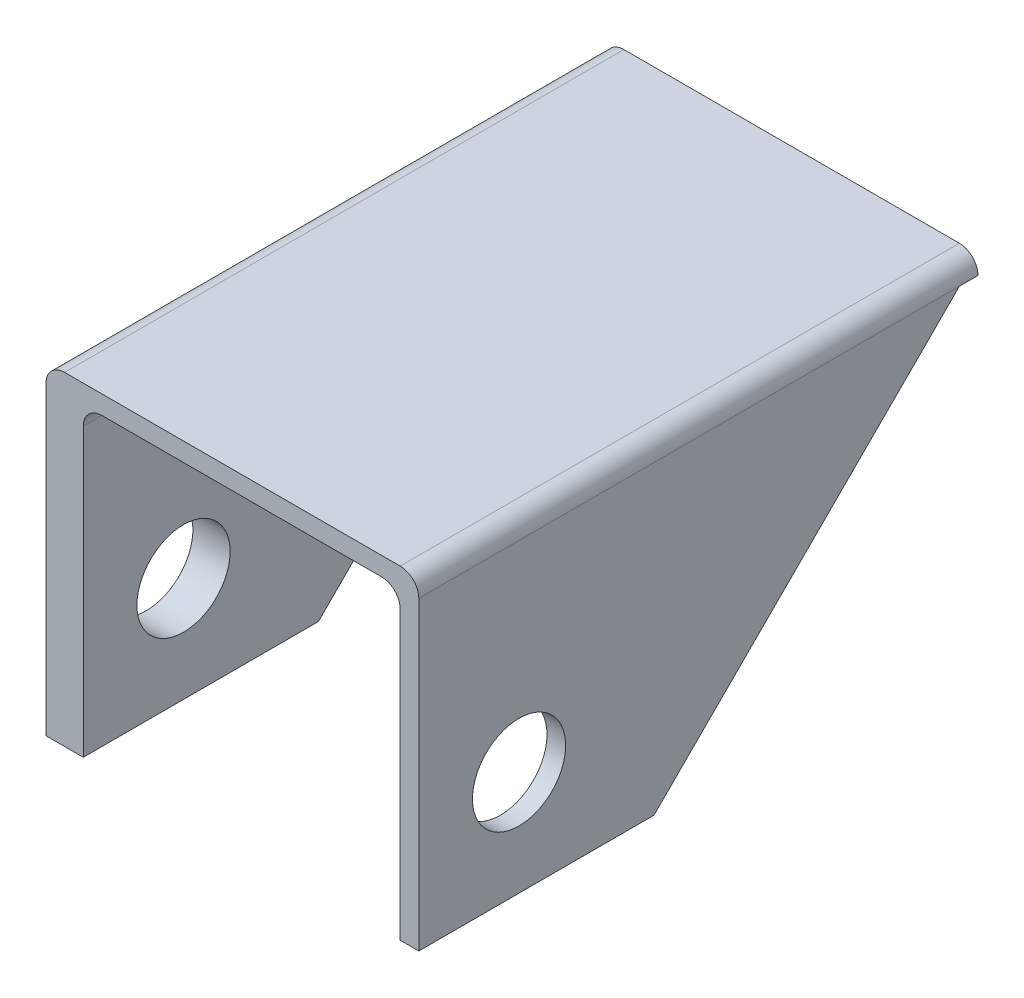
from build123d import *

# Parameters (mm, degrees)
BOSS_EXTRUDE1_DEPTH     = 1
SKETCH2_W               = 20
SKETCH2_H               = 30
BOSS_EXTRUDE2_DEPTH     = 1
MIRROR1_START           = 1
MIRROR1_DEPTH           = 1
MIRROR1_START_2         = 19
MIRROR1_2_DEPTH         = 1
FILLET1_R               = 1
CUT_EXTRUDE1_DEPTH      = 44.502679315
CUT_EXTRUDE1_DEPTH_BACK = 44.502679315
SKETCH3_R               = 2.5
CUT_EXTRUDE2_DEPTH      = 44.502679315
CUT_EXTRUDE2_DEPTH_BACK = 44.502679315
SKETCH4_W               = 27.584874686
SKETCH4_H               = 17.882608418


# Read off the part's stored shape, not the designer's step: Mirror1
with BuildPart() as part:
    # Sketch1 → Boss-Extrude1 (new body)
    with BuildSketch(Plane(origin=(0, 0, 0), x_dir=(0, 0, -1), z_dir=(1, 0, 0))):
        Polygon((0, 24.340975897), (30, 24.340975897), (0, -5.659024103), align=None)
    extrude(amount=BOSS_EXTRUDE1_DEPTH)

    # Sketch2 → Boss-Extrude2 (add)
    with BuildSketch(Plane(origin=(0, 24.340975897, 0), x_dir=(1, 0, 0), z_dir=(0, 1, 0))):
        with Locations((10, 15)):
            Rectangle(SKETCH2_W, SKETCH2_H)
    extrude(amount=-BOSS_EXTRUDE2_DEPTH)

    # Mirror1 outline → Mirror1 (add)
    with BuildSketch(Plane.YZ.offset(MIRROR1_START)):
        Polygon((-5.659024103, 0), (23.340975897, -29), (23.340975897, 0), align=None)
    extrude(amount=MIRROR1_DEPTH)

    # Mirror1 2 outline → Mirror1 2 (add)
    with BuildSketch(Plane.YZ.offset(MIRROR1_START_2)):
        Polygon((-5.659024103, 0), (23.340975897, -29), (23.340975897, 0), align=None)
    extrude(amount=MIRROR1_2_DEPTH)

    # Fillet1
    fillet1_edges = [part.edges().sort_by_distance(p)[0] for p in [
        (20, 24.340975897, -15),
        (19, 23.340975897, -14.5),
        (0, 24.340975897, -15),
        (2, 23.340975897, -14.5),
    ]]
    fillet(fillet1_edges, radius=FILLET1_R - 0.0001)  # a hair under: the kernel refuses the full size

    # Sketch3 → Cut-Extrude1 (cut, two sides: drawn at the far end of the back side and taken through both)
    with BuildSketch(Plane.ZY.offset(-CUT_EXTRUDE1_DEPTH_BACK)):
        with Locations((-5.377949805, 12.578820342)):
            Circle(SKETCH3_R)
    extrude(amount=CUT_EXTRUDE1_DEPTH + CUT_EXTRUDE1_DEPTH_BACK, mode=Mode.SUBTRACT)

    # Sketch4 → Cut-Extrude2 (cut, two sides: drawn at the far end of the back side and taken through both)
    with BuildSketch(Plane.ZY.offset(-CUT_EXTRUDE2_DEPTH_BACK)):
        with Locations((-7.379594799, -1.984577464)):
            Rectangle(SKETCH4_W, SKETCH4_H)
    extrude(amount=CUT_EXTRUDE2_DEPTH + CUT_EXTRUDE2_DEPTH_BACK, mode=Mode.SUBTRACT)


solid = part.part
